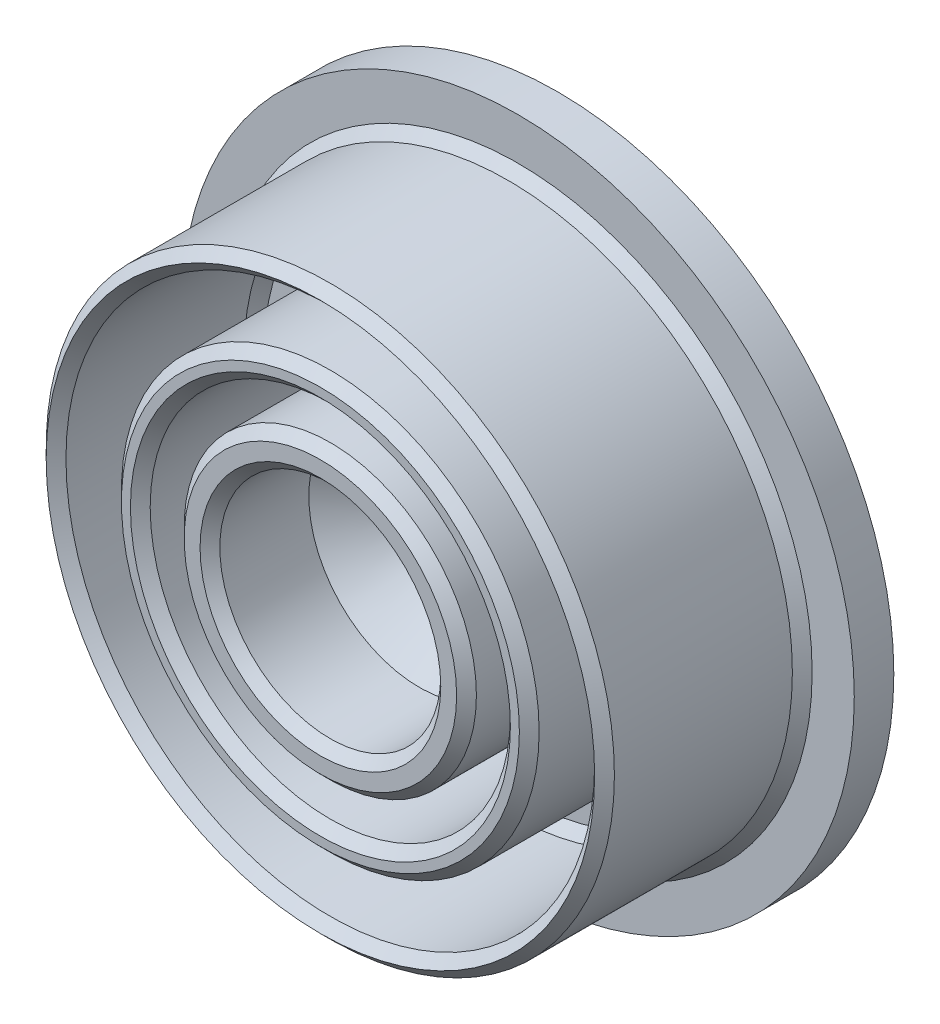
from build123d import *

# Parameters (mm, degrees)
SKETCH1_R           = 17
SKETCH1_R_2         = 15.796210214
SKETCH1_R_3         = 14.369088414
SKETCH1_R_4         = 13.369088414
SKETCH1_R_5         = 10.562338101
SKETCH1_R_6         = 9.108597541
SKETCH1_R_7         = 7.390019335
SKETCH1_R_8         = 5.587157692
BOSS_EXTRUDE1_DEPTH = 2
SKETCH1_3_R         = 14.369088414
SKETCH1_3_R_2       = 13.369088414
SKETCH1_3_R_3       = 10.562338101
SKETCH1_3_R_4       = 9.108597541
SKETCH1_3_R_5       = 7.390019335
SKETCH1_3_R_6       = 5.587157692
BOSS_EXTRUDE2_DEPTH = 10
CHAMFER3_SIZE       = 5
CHAMFER4_SIZE       = 0.5
CHAMFER5_SIZE       = 0.5


with BuildPart() as part:
    # Sketch1 → Boss-Extrude1 (new body)
    # profile 1 of 8: a face of its own
    with BuildSketch(Plane.XY):
        Circle(SKETCH1_R)
        Circle(SKETCH1_R_2, mode=Mode.SUBTRACT)
    # profile 2 of 8: a face of its own
    with BuildSketch(Plane.XY):
        Circle(SKETCH1_R_2)
        Circle(SKETCH1_R_3, mode=Mode.SUBTRACT)
    # profile 3 of 8: a face of its own
    with BuildSketch(Plane.XY):
        Circle(SKETCH1_R_3)
        Circle(SKETCH1_R_4, mode=Mode.SUBTRACT)
    # profile 4 of 8: a face of its own
    with BuildSketch(Plane.XY):
        Circle(SKETCH1_R_4)
        Circle(SKETCH1_R_5, mode=Mode.SUBTRACT)
    # profile 5 of 8: a face of its own
    with BuildSketch(Plane.XY):
        Circle(SKETCH1_R_5)
        Circle(SKETCH1_R_6, mode=Mode.SUBTRACT)
    # profile 6 of 8: a face of its own
    with BuildSketch(Plane.XY):
        Circle(SKETCH1_R_6)
        Circle(SKETCH1_R_7, mode=Mode.SUBTRACT)
    # profile 7 of 8: a face of its own
    with BuildSketch(Plane.XY):
        Circle(SKETCH1_R_7)
        Circle(SKETCH1_R_8, mode=Mode.SUBTRACT)
    # profile 8 of 8: a face of its own
    with BuildSketch(Plane.XY):
        Circle(SKETCH1_R_8)
    extrude(amount=-BOSS_EXTRUDE1_DEPTH)

    # Sketch1<3> → Boss-Extrude2 (add)
    # profile 1 of 3: a face of its own
    with BuildSketch(Plane.XY):
        Circle(SKETCH1_3_R)
        Circle(SKETCH1_3_R_2, mode=Mode.SUBTRACT)
    # profile 2 of 3: a face of its own
    with BuildSketch(Plane.XY):
        Circle(SKETCH1_3_R_3)
        Circle(SKETCH1_3_R_4, mode=Mode.SUBTRACT)
    # profile 3 of 3: a face of its own
    with BuildSketch(Plane.XY):
        Circle(SKETCH1_3_R_5)
        Circle(SKETCH1_3_R_6, mode=Mode.SUBTRACT)
    extrude(amount=BOSS_EXTRUDE2_DEPTH)

    # Chamfer3
    chamfer3_edges = [part.edges().sort_by_distance(p)[0] for p in [
        (-5.587157692, 0, 0),
    ]]
    chamfer(chamfer3_edges, length=CHAMFER3_SIZE)

    # Chamfer4
    chamfer4_edges = [part.edges().sort_by_distance(p)[0] for p in [
        (-9.108597541, 0, 0),
        (-10.562338101, 0, 0),
        (-7.390019335, 0, 0),
        (-14.369088414, 0, 0),
        (-13.369088414, 0, 0),
    ]]
    chamfer(chamfer4_edges, length=CHAMFER4_SIZE)

    # Chamfer5
    chamfer5_edges = [part.edges().sort_by_distance(p)[0] for p in [
        (-9.108597541, 0, 10),
        (-10.562338101, 0, 10),
        (-5.587157692, 0, 10),
        (-7.390019335, 0, 10),
        (-13.369088414, 0, 10),
        (-14.369088414, 0, 10),
    ]]
    chamfer(chamfer5_edges, length=CHAMFER5_SIZE - 0.0001)  # a hair under: the kernel refuses the full size


solid = part.part
